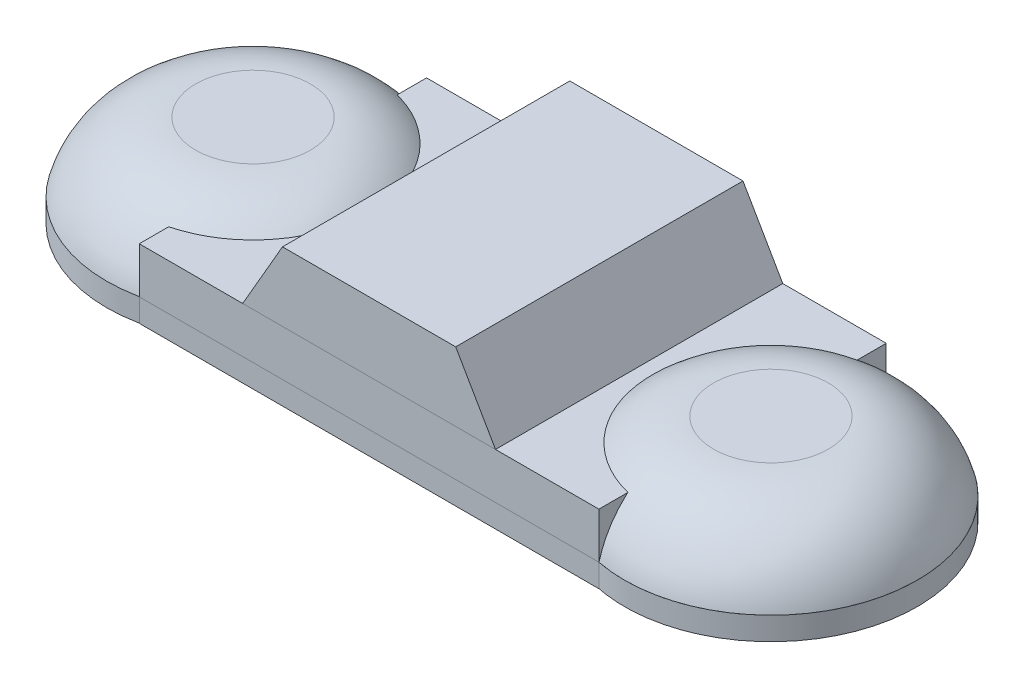
from build123d import *

# Parameters (mm, degrees)
BOSS_EXTRUDE1_DEPTH   = 0.1
SKETCH2_R             = 0.637065443
BOSS_EXTRUDE2_DEPTH   = 0.1
BOSS_EXTRUDE2_2_DEPTH = 0.1
BOSS_EXTRUDE3_DEPTH   = 0.2
SKETCH5_R             = 0.637065443
BOSS_EXTRUDE4_DEPTH   = 0.3
SKETCH6_R             = 0.637065443
BOSS_EXTRUDE5_DEPTH   = 0.3
FILLET1_R             = 0.4
FILLET2_R             = 0.4
SKETCH10_W            = 1.1
SKETCH10_H            = 1.25
BOSS_EXTRUDE6_DEPTH   = 0.3
CHAMFER1_SIZE         = 0.3
CHAMFER1_SIZE_2       = 0.173205081


with BuildPart() as part:
    # Sketch1 → Boss-Extrude1 (new body)
    with BuildSketch(Plane(origin=(0, 0, 0), x_dir=(1, 0, 0), z_dir=(0, 1, 0))):
        with BuildLine():
            ThreePointArc((1.003239919, 0.366587161), (0.753239919, -0.004222763), (1.003239919, -0.375032687))
            Line((1.003239919, -0.375032687), (1.003239919, -0.629222763))
            Line((1.003239919, -0.629222763), (-0.996760081, -0.629222763))
            Line((-0.996760081, -0.629222763), (-0.996760081, -0.374094755))
            ThreePointArc((-0.996760081, -0.374094755), (-0.747629413, -0.004222763), (-0.996760081, 0.365649229))
            Line((-0.996760081, 0.365649229), (-0.996760081, 0.620777237))
            Line((-0.996760081, 0.620777237), (1.003239919, 0.620777237))
            Line((1.003239919, 0.620777237), (1.003239919, 0.366587161))
        make_face()
    extrude(amount=BOSS_EXTRUDE1_DEPTH)


with BuildPart() as body_2:
    # Sketch2 → Boss-Extrude2 (new body)
    with BuildSketch(Plane.XZ):
        with Locations(Location((-1.126639185, 0.004222763, 0), (0, 0, 90))):
            Circle(SKETCH2_R)
    extrude(amount=-BOSS_EXTRUDE2_DEPTH)


with BuildPart() as body_3:
    # Sketch2 → Boss-Extrude2 2 (new body)
    with BuildSketch(Plane.XZ):
        with Locations(Location((1.126639185, 0.004222763, 0), (0, 0, 270))):
            Circle(SKETCH2_R)
    extrude(amount=-BOSS_EXTRUDE2_2_DEPTH)


with BuildPart() as body_4:
    # Sketch4 → Boss-Extrude3 (new body)
    with BuildSketch(Plane(origin=(0, 0.1, 0), x_dir=(1, 0, 0), z_dir=(0, 1, 0))):
        with BuildLine():
            Line((1.003239919, 0.366587161), (1.003239919, 0.620777237))
            Line((1.003239919, 0.620777237), (-0.996760081, 0.620777237))
            Line((-0.996760081, 0.620777237), (-0.996760081, 0.365649229))
            ThreePointArc((-0.996760081, 0.365649229), (-0.747629413, -0.004222763), (-0.996760081, -0.374094755))
            Line((-0.996760081, -0.374094755), (-0.996760081, -0.629222763))
            Line((-0.996760081, -0.629222763), (1.003239919, -0.629222763))
            Line((1.003239919, -0.629222763), (1.003239919, -0.375032687))
            ThreePointArc((1.003239919, -0.375032687), (0.753239919, -0.004222763), (1.003239919, 0.366587161))
        make_face()
    extrude(amount=BOSS_EXTRUDE3_DEPTH)


with BuildPart() as body_5:
    # Sketch5 → Boss-Extrude4 (new body)
    with BuildSketch(Plane(origin=(0, 0.1, 0), x_dir=(1, 0, 0), z_dir=(0, 1, 0))):
        with Locations(Location((1.126639185, -0.004222763, 0), (0, 0, 270))):
            Circle(SKETCH5_R)
    extrude(amount=BOSS_EXTRUDE4_DEPTH)

    # Fillet1
    # the kernel refuses this fillet: 0.4 mm, written as the material it takes off along each edge
    with BuildSketch(Plane(origin=(1.126639185, 0.4, 0.004222763), x_dir=(0, 0, 1), z_dir=(-1, 0, 0))) as fillet1_piece_1:
        with BuildLine():
            CenterArc((0.249767109, -0.4), FILLET1_R, 14.477512186, 75.522487814)
            Line((0.249767109, 0), (0.249767109, 0.008))
            Line((0.249767109, 0.008), (0.637065443, 0.008))
            Line((0.637065443, 0.008), (0.645065443, 0))
            ThreePointArc((0.645065443, 0), (0.645065443, -0.15), (0.64481141, -0.298))
            Line((0.64481141, -0.298), (0.637065443, -0.3))
        make_face()
    revolve(axis=Axis((1.126639185, 0.4, 0.004222763), (0, 1, 0)), mode=Mode.SUBTRACT)


with BuildPart() as body_6:
    # Sketch6 → Boss-Extrude5 (new body)
    with BuildSketch(Plane(origin=(0, 0.1, 0), x_dir=(1, 0, 0), z_dir=(0, 1, 0))):
        with Locations(Location((-1.126639185, -0.004222763, 0), (0, 0, 270))):
            Circle(SKETCH6_R)
    extrude(amount=BOSS_EXTRUDE5_DEPTH)

    # Fillet2
    # the kernel refuses this fillet: 0.4 mm, written as the material it takes off along each edge
    with BuildSketch(Plane(origin=(-1.126639185, 0.4, 0.004222763), x_dir=(0, 0, 1), z_dir=(-1, 0, 0))) as fillet2_piece_1:
        with BuildLine():
            CenterArc((0.249767109, -0.4), FILLET2_R, 14.477512186, 75.522487814)
            Line((0.249767109, 0), (0.249767109, 0.008))
            Line((0.249767109, 0.008), (0.637065443, 0.008))
            Line((0.637065443, 0.008), (0.645065443, 0))
            ThreePointArc((0.645065443, 0), (0.645065443, -0.15), (0.64481141, -0.298))
            Line((0.64481141, -0.298), (0.637065443, -0.3))
        make_face()
    revolve(axis=Axis((-1.126639185, 0.4, 0.004222763), (0, 1, 0)), mode=Mode.SUBTRACT)


with BuildPart() as body_7:
    # Sketch10 → Boss-Extrude6 (new body)
    with BuildSketch(Plane(origin=(0, 0.3, 0), x_dir=(1, 0, 0), z_dir=(0, 1, 0))):
        with Locations((0.003239919, -0.004222763)):
            Rectangle(SKETCH10_W, SKETCH10_H)
    extrude(amount=BOSS_EXTRUDE6_DEPTH)

    # Chamfer1
    # the kernel refuses this chamfer: 0.3, 0.173205081 mm, written as the material it takes off along each edge
    with BuildSketch(Plane(origin=(-0.546760081, 0.6, -1.396902964), x_dir=(-0.019326765612700723, -0.999813220622208, 0), z_dir=(0, 0, 1)), Plane(origin=(0.553239919, 0.6, 1.405348489), x_dir=(0.019326765612700723, -0.999813220622208, 0), z_dir=(0, 0, -1))) as chamfer1_piece_1:
        Polygon((CHAMFER1_SIZE * 0.999813220622, CHAMFER1_SIZE * 0.0193267656127), (-CHAMFER1_SIZE_2 * 0.0193267655856, CHAMFER1_SIZE_2 * 0.999813219219), (0, 0), align=None)
    extrude(amount=2.802251453, mode=Mode.SUBTRACT)


solid = Compound([part.part, body_2.part, body_3.part, body_4.part, body_5.part, body_6.part, body_7.part])
